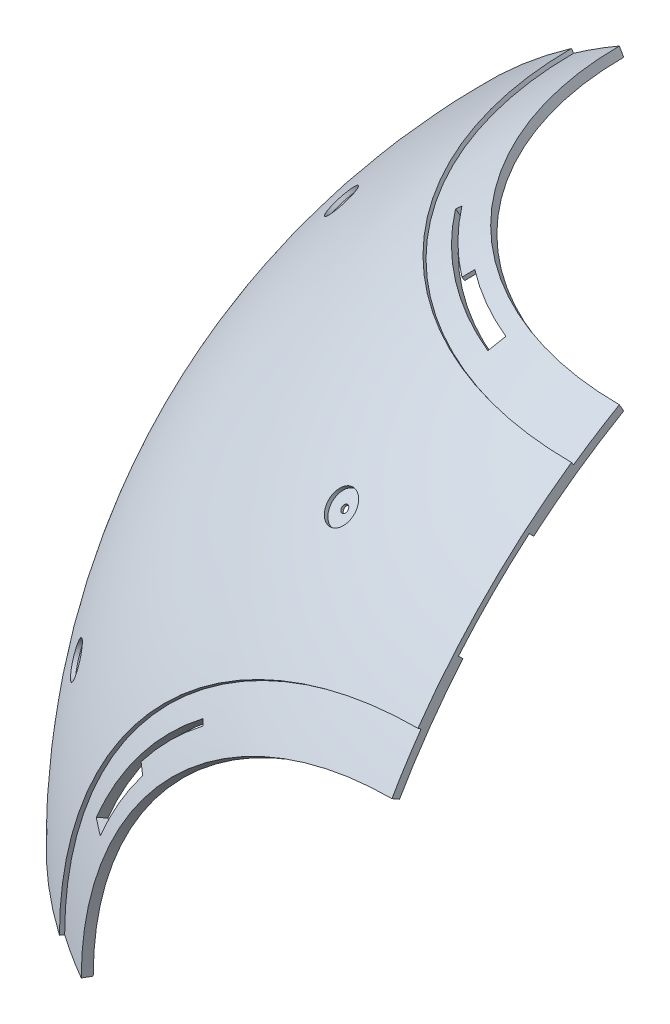
from build123d import *

# Parameters (mm, degrees)
REVOLVE1_ANGLE     = 90
CUT_REVOLVE4_ANGLE = 15
CUT_REVOLVE5_ANGLE = 15
CIRPATTERN5_COUNT  = 3
CUT_REVOLVE6_ANGLE = 20
CIRPATTERN6_COUNT  = 3
CIRPATTERN8_COUNT  = 3


with BuildPart() as part:
    # Sketch1 → Revolve1 (revolve)
    with BuildSketch(Plane.XY):
        with BuildLine():
            ThreePointArc((-245, 0), (-212.176223927, 122.5), (-122.5, 212.176223927))
            Line((-122.5, 212.176223927), (-124.25, 215.20731284))
            ThreePointArc((-124.25, 215.20731284), (-133.518952674, 209.582774285), (-142.533744433, 203.559283006))
            Line((-142.533744433, 203.559283006), (-143.394109088, 204.788011072))
            ThreePointArc((-143.394109088, 204.788011072), (-221.752708295, 115.437153309), (-250, 0))
            Line((-250, 0), (-245, 0))
        make_face()
    revolve(axis=Axis((0, 0, 0), (0, 1, 0)), revolution_arc=REVOLVE1_ANGLE)

    # Sketch2 → Cut-Revolve2 (revolve, cut)
    with BuildSketch(Plane(origin=(0, 0, 0), x_dir=(0, 0, -1), z_dir=(1, 0, 0))):
        with BuildLine():
            Line((-250, 0), (-245, 0))
            ThreePointArc((-245, 0), (-236.651827441, 63.41066605), (-212.176223927, 122.5))
            Line((-212.176223927, 122.5), (-215.20731284, 124.25))
            ThreePointArc((-215.20731284, 124.25), (-209.582774285, 133.518952674), (-203.559283006, 142.533744433))
            Line((-203.559283006, 142.533744433), (-204.788011072, 143.394109088))
            ThreePointArc((-204.788011072, 143.394109088), (-238.429237687, 75.176449876), (-250, 0))
        make_face()
    revolve(axis=Axis((0, 0, 0), (0, 0, 1)), mode=Mode.SUBTRACT)

    # Sketch3 → Cut-Revolve3 (revolve, cut)
    with BuildSketch(Plane(origin=(0, 0, 0), x_dir=(-1, 0, 0), z_dir=(0, 0, -1))):
        with BuildLine():
            ThreePointArc((212.176223927, 122.5), (236.651827441, 63.41066605), (245, 0))
            Line((245, 0), (250, 0))
            ThreePointArc((250, 0), (238.429237687, 75.176449876), (204.788011072, 143.394109088))
            Line((204.788011072, 143.394109088), (203.559283006, 142.533744433))
            ThreePointArc((203.559283006, 142.533744433), (209.582774285, 133.518952674), (215.20731284, 124.25))
            Line((215.20731284, 124.25), (212.176223927, 122.5))
        make_face()
    revolve(axis=Axis((0, 0, 0), (-1, 0, 0)), mode=Mode.SUBTRACT)

    # Sketch11 → Cut-Revolve4 (revolve, cut)
    with BuildSketch(Plane(origin=(0, 0, 0), x_dir=(-1, 0, 0), z_dir=(0, -0.3826834323650906, 0.9238795325112865))):
        with BuildLine():
            Line((211.881080842, -129.840893332), (208.896840267, -128.012148355))
            ThreePointArc((208.896840267, -128.012148355), (207.203316317, -130.735556399), (205.474289147, -133.436563579))
            Line((205.474289147, -133.436563579), (208.409636134, -135.342800201))
            ThreePointArc((208.409636134, -135.342800201), (210.163363693, -132.603207205), (211.881080842, -129.840893332))
        make_face()
    cut_revolve4 = revolve(axis=Axis((0, 0, 0), (1, 0, 0)), revolution_arc=CUT_REVOLVE4_ANGLE, mode=Mode.SUBTRACT)

    # Sketch12 → Cut-Revolve5 (revolve, cut)
    with BuildSketch(Plane(origin=(0, 0, 0), x_dir=(1, 0, 0), z_dir=(0, 0.6087614290087219, -0.7933533402912343))):
        with BuildLine():
            ThreePointArc((-205.474289147, -133.436563579), (-207.203316317, -130.735556399), (-208.896840267, -128.012148355))
            Line((-208.896840267, -128.012148355), (-210.602120595, -129.057145485))
            ThreePointArc((-210.602120595, -129.057145485), (-209.467879751, -130.890058266), (-208.317687116, -132.713003262))
            Line((-208.317687116, -132.713003262), (-209.582774285, -133.518952674))
            ThreePointArc((-209.582774285, -133.518952674), (-208.998194722, -134.432156135), (-208.409636134, -135.342800201))
            Line((-208.409636134, -135.342800201), (-205.474289147, -133.436563579))
        make_face()
    cut_revolve5 = revolve(axis=Axis((0, 0, 0), (1, 0, 0)), revolution_arc=CUT_REVOLVE5_ANGLE, mode=Mode.SUBTRACT)

    # CirPattern5: Cut-Revolve4, Cut-Revolve5 ×3 about axis
    cirpattern5_axis = Axis((9.468761978, -9.468761978, -9.468761978), (-0.5773502691896264, 0.5773502691896245, 0.5773502691896264))
    add([cut_revolve4.rotate(cirpattern5_axis, i * 360 / CIRPATTERN5_COUNT) for i in range(1, CIRPATTERN5_COUNT)], mode=Mode.SUBTRACT)
    add([cut_revolve5.rotate(cirpattern5_axis, i * 360 / CIRPATTERN5_COUNT) for i in range(1, CIRPATTERN5_COUNT)], mode=Mode.SUBTRACT)

    # Sketch20 → Cut-Revolve6 (revolve, cut)
    with BuildSketch(Plane.XZ):
        with BuildLine():
            ThreePointArc((-186.805102122, 158.520830875), (-173.241161391, 173.241161391), (-158.520830875, 186.805102122))
            Line((-158.520830875, 186.805102122), (-160.294457441, 188.578728688))
            ThreePointArc((-160.294457441, 188.578728688), (-175.008928344, 175.008928344), (-188.578728688, 160.294457441))
            Line((-188.578728688, 160.294457441), (-186.805102122, 158.520830875))
        make_face()
    cut_revolve6 = revolve(axis=Axis((-45.47865642, 0, -45.47865642), (-0.7071067811865476, 0, -0.7071067811865476)), revolution_arc=CUT_REVOLVE6_ANGLE, mode=Mode.SUBTRACT)

    # CirPattern6: Cut-Revolve6 ×3 about axis
    cirpattern6_axis = Axis((9.468761978, -9.468761978, -9.468761978), (-0.5773502691896264, 0.5773502691896245, 0.5773502691896264))
    for i in range(1, CIRPATTERN6_COUNT):
        add(cut_revolve6.rotate(cirpattern6_axis, i * 360 / CIRPATTERN6_COUNT), mode=Mode.SUBTRACT)

    # Sketch22 → Cut-Revolve13 (revolve, cut)
    with BuildSketch(Plane(origin=(0, 0, 0), x_dir=(-0.7071067811865475, 0, 0.7071067811865476), z_dir=(-0.7071067811865476, 0, -0.7071067811865475))):
        with BuildLine():
            ThreePointArc((226.549110336, 60.703651161), (226.742067307, 59.97889272), (226.932705692, 59.253520956))
            Line((226.932705692, 59.253520956), (240.416423457, 62.866472242))
            ThreePointArc((240.416423457, 62.866472242), (241.036795054, 60.444300227), (241.632764163, 58.01600885))
            Line((241.632764163, 58.01600885), (243.082145835, 58.404369498))
            ThreePointArc((243.082145835, 58.404369498), (242.302280073, 61.559768287), (241.481456572, 64.704761276))
            Line((241.481456572, 64.704761276), (226.549110336, 60.703651161))
        make_face()
    cut_revolve13 = revolve(axis=Axis((0, 0, 0), (-0.6830127018922192, 0.2588190451025214, 0.6830127018922193)), mode=Mode.SUBTRACT)

    # CirPattern8: Cut-Revolve13 ×3 about axis
    cirpattern8_axis = Axis((9.468761978, -9.468761978, -9.468761978), (-0.5773502691896264, 0.5773502691896245, 0.5773502691896264))
    for i in range(1, CIRPATTERN8_COUNT):
        add(cut_revolve13.rotate(cirpattern8_axis, i * 360 / CIRPATTERN8_COUNT), mode=Mode.SUBTRACT)


solid = part.part
